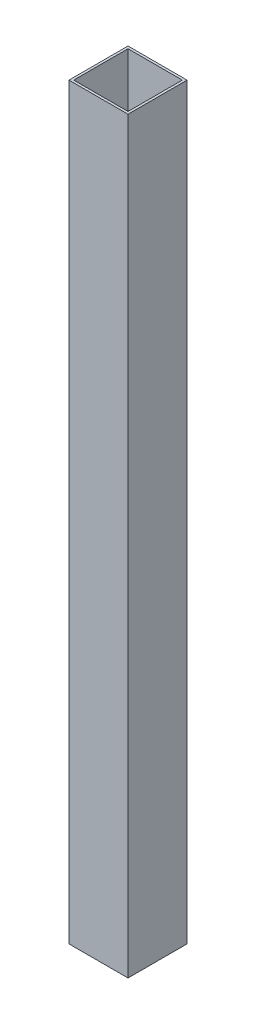
from build123d import *

# Parameters (mm, degrees)
SKETCH1_W           = 38.1
SKETCH1_H           = 38.1
SKETCH1_W_2         = 35.052
SKETCH1_H_2         = 35.052
EXTRUDE_THIN1_DEPTH = 482.6


with BuildPart() as part:
    # Sketch1 → Extrude-Thin1 (new body)
    with BuildSketch(Plane(origin=(0, 0, 0), x_dir=(1, 0, 0), z_dir=(0, 1, 0))):
        Rectangle(SKETCH1_W, SKETCH1_H)
        Rectangle(SKETCH1_W_2, SKETCH1_H_2, mode=Mode.SUBTRACT)
    extrude(amount=EXTRUDE_THIN1_DEPTH)


solid = part.part
